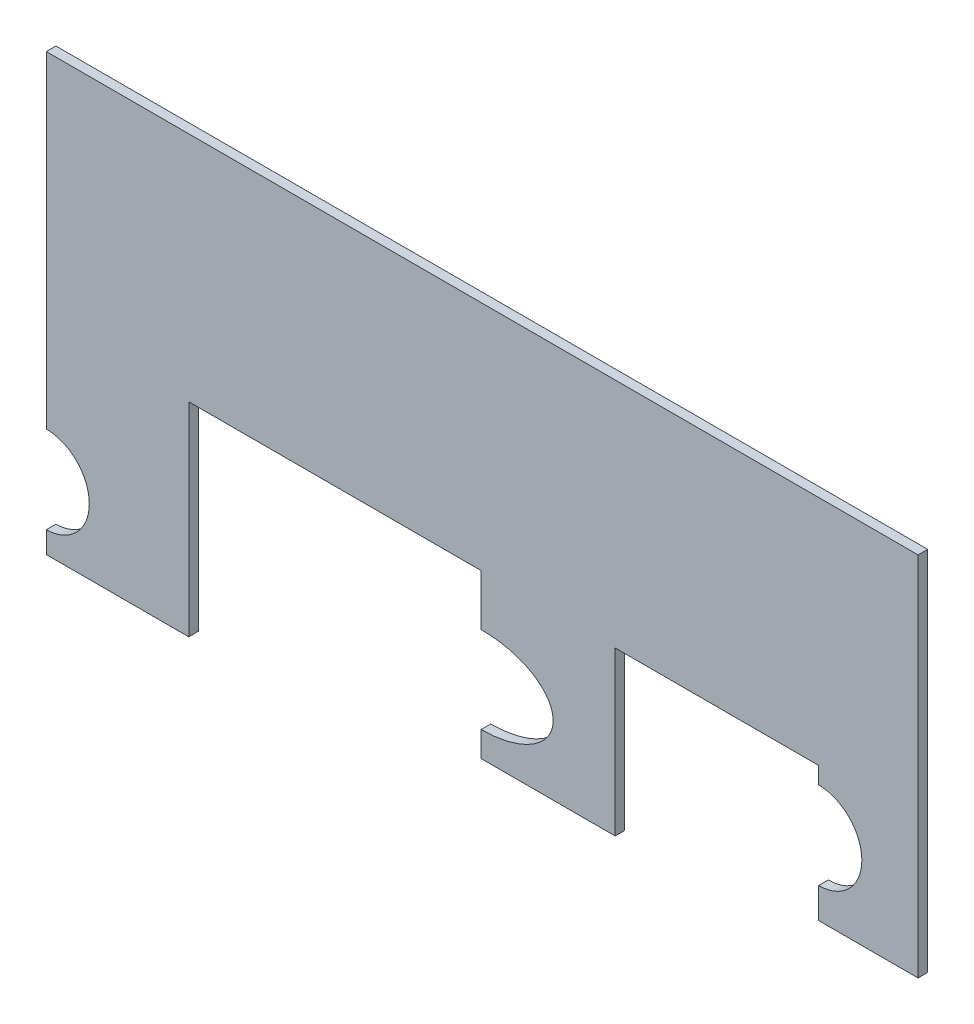
from build123d import *

# Parameters (mm, degrees)
BOSS_EXTRUDE3_OUTLINE_W = 330.2
BOSS_EXTRUDE3_OUTLINE_H = 190.5
BOSS_EXTRUDE3_DEPTH     = 3
CUT_EXTRUDE2_DEPTH      = 554.733952504


# Read off the part's stored shape, not the designer's step: Boss-Extrude3
with BuildPart() as part:
    # Boss-Extrude3 outline → Boss-Extrude3 (new body)
    with BuildSketch(Plane.XY):
        with Locations((-165.1, -349.25)):
            Rectangle(BOSS_EXTRUDE3_OUTLINE_W, BOSS_EXTRUDE3_OUTLINE_H)
        with BuildLine():
            add(Edge.make_bspline(
                [(-278.621518652, -381.53819229), (-278.370340025, -381.675788485), (-277.859461829, -381.935426093), (-276.719402462, -382.422402226), (-274.453837446, -383.121197535), (-270.353871795, -383.430649395), (-265.517981506, -381.766237097), (-262.122707267, -378.912933368), (-260.111865445, -376.132298445), (-258.851133292, -372.940751822), (-258.274482706, -368.543399957), (-259.475297643, -363.572067472), (-261.943328375, -360.2835567), (-263.751900196, -358.750531033), (-264.776043253, -358.051952395), (-265.516797717, -357.615831636), (-266.283115012, -357.226375224), (-267.423174378, -356.739399091), (-269.688739395, -356.040603782), (-273.788705045, -355.731151923), (-278.624595335, -357.395564221), (-282.019869573, -360.248867949), (-284.030711396, -363.029502872), (-285.291443548, -366.221049495), (-285.868094135, -370.61840136), (-284.667279197, -375.589733845), (-282.199248466, -378.878244617), (-280.390676644, -380.411270284), (-279.366533588, -381.109848922), (-278.872697278, -381.400596095), (-278.621518652, -381.53819229)],
                knots=[0, 0, 0, 0, 0.015625, 0.03125, 0.0625, 0.125, 0.1875, 0.21875, 0.25, 0.28125, 0.3125, 0.375, 0.4375, 0.46875, 0.484375, 0.5, 0.515625, 0.53125, 0.5625, 0.625, 0.6875, 0.71875, 0.75, 0.78125, 0.8125, 0.875, 0.9375, 0.96875, 0.984375, 1, 1, 1, 1], degree=3))
        make_face(mode=Mode.SUBTRACT)
        with BuildLine():
            add(Edge.make_bspline(
                [(-158.330065967, -356.075599307), (-158.327001416, -356.373395786), (-158.290080957, -356.968671877), (-158.067598918, -358.246608867), (-157.224453748, -360.63292192), (-154.882508758, -363.615638807), (-150.614101822, -366.327010398), (-146.438166973, -368.010630749), (-141.434805852, -369.121724295), (-135.953318408, -369.477027412), (-130.480303716, -369.0089942), (-125.500867751, -367.795170138), (-121.360465048, -366.025968397), (-117.148760273, -363.227330056), (-114.868693567, -360.19704918), (-114.074835681, -357.79389013), (-113.878699845, -356.511645246), (-113.84170646, -355.617780511), (-113.897087149, -354.724866375), (-114.119569188, -353.446929384), (-114.962714357, -351.060616332), (-117.304659348, -348.077899444), (-121.573066284, -345.366527853), (-125.749001132, -343.682907503), (-130.752362254, -342.571813956), (-136.233849698, -342.216510839), (-141.70686439, -342.684544051), (-146.686300354, -343.898368114), (-150.826703058, -345.667569854), (-155.038407833, -348.466208196), (-157.318474538, -351.496489072), (-158.112332425, -353.899648121), (-158.30846826, -355.181893006), (-158.333130517, -355.777802829), (-158.330065967, -356.075599307)],
                knots=[0, 0, 0, 0, 0.015625, 0.03125, 0.0625, 0.125, 0.15625, 0.1875, 0.21875, 0.25, 0.28125, 0.3125, 0.34375, 0.375, 0.4375, 0.46875, 0.484375, 0.5, 0.515625, 0.53125, 0.5625, 0.625, 0.65625, 0.6875, 0.71875, 0.75, 0.78125, 0.8125, 0.84375, 0.875, 0.9375, 0.96875, 0.984375, 1, 1, 1, 1], degree=3))
        make_face(mode=Mode.SUBTRACT)
        with BuildLine():
            add(Edge.make_bspline(
                [(-33.964165547, -331.962198832), (-34.243868077, -332.023492326), (-34.799490244, -332.1633419), (-35.978750805, -332.544818645), (-38.145753578, -333.504844289), (-41.440772349, -335.959441018), (-43.995962688, -340.379536121), (-44.684039348, -344.749082337), (-44.375298942, -348.156558861), (-43.230759499, -351.380879931), (-40.778421797, -355.062241557), (-36.608937685, -358.008703948), (-32.589384281, -358.86039887), (-30.219493581, -358.826218077), (-28.988771838, -358.679575761), (-28.143989915, -358.521589154), (-27.310556664, -358.311814794), (-26.131296103, -357.930338049), (-23.96429333, -356.970312405), (-20.669274558, -354.515715676), (-18.11408422, -350.095620573), (-17.42600756, -345.726074356), (-17.734747965, -342.318597833), (-18.879287408, -339.094276763), (-21.331625111, -335.412915137), (-25.501109223, -332.466452745), (-29.520662627, -331.614757823), (-31.890553327, -331.648938617), (-33.121275069, -331.795580933), (-33.684463018, -331.900905337), (-33.964165547, -331.962198832)],
                knots=[0, 0, 0, 0, 0.015625, 0.03125, 0.0625, 0.125, 0.1875, 0.21875, 0.25, 0.28125, 0.3125, 0.375, 0.4375, 0.46875, 0.484375, 0.5, 0.515625, 0.53125, 0.5625, 0.625, 0.6875, 0.71875, 0.75, 0.78125, 0.8125, 0.875, 0.9375, 0.96875, 0.984375, 1, 1, 1, 1], degree=3))
        make_face(mode=Mode.SUBTRACT)
    extrude(amount=BOSS_EXTRUDE3_DEPTH)

    # Sketch9 → Cut-Extrude2 (cut, through all)
    with BuildSketch(Plane(origin=(0, 0, 0), x_dir=(-1, 0, 0), z_dir=(0, 0, -1))):
        with BuildLine():
            Line((0, -444.5), (330.2, -444.5))
            Line((330.2, -444.5), (330.2, -254))
            Line((330.2, -254), (271.955362236, -254))
            Line((271.955362236, -254), (271.955362236, -355.976421692))
            add(Edge.make_bspline(
                [(271.955362236, -355.976421692), (272.59093246, -355.976421692), (274.983557944, -356.142395301), (278.624595335, -357.395564221), (282.019869573, -360.248867949), (284.030711396, -363.029502872), (285.291443548, -366.221049495), (285.868094135, -370.61840136), (284.667279197, -375.589733845), (282.199248466, -378.878244617), (280.390676644, -380.411270284), (279.366533588, -381.109848922), (278.872697278, -381.400596095), (278.621518652, -381.53819229)],
                knots=[0.601106286, 0.601106286, 0.601106286, 0.601106286, 0.625, 0.6875, 0.71875, 0.75, 0.78125, 0.8125, 0.875, 0.9375, 0.96875, 0.984375, 1, 1, 1, 1], degree=3))
            add(Edge.make_bspline(
                [(278.621518652, -381.53819229), (278.370340025, -381.675788485), (277.859461829, -381.935426093), (276.719402462, -382.422402226), (274.88887928, -382.98701238), (273.070063108, -383.202935147), (271.955362236, -383.183342538)],
                knots=[0, 0, 0, 0, 0.015625, 0.03125, 0.0625, 0.103997424, 0.103997424, 0.103997424, 0.103997424], degree=3))
            Line((271.955362236, -383.183342538), (271.955362236, -389.89))
            Line((271.955362236, -389.89), (227.505362236, -389.89))
            Line((227.505362236, -389.89), (227.505362236, -326.39))
            Line((227.505362236, -326.39), (136.330752091, -326.39))
            Line((136.330752091, -326.39), (136.330752091, -342.354877875))
            add(Edge.make_bspline(
                [(136.330752091, -342.354877875), (138.123654962, -342.378162739), (141.736657922, -342.691806742), (146.686300354, -343.898368114), (150.826703058, -345.667569854), (155.038407833, -348.466208196), (157.318474538, -351.496489072), (158.112332425, -353.899648121), (158.30846826, -355.181893006), (158.333130517, -355.777802829), (158.330065967, -356.075599307)],
                knots=[0.750560936, 0.750560936, 0.750560936, 0.750560936, 0.78125, 0.8125, 0.84375, 0.875, 0.9375, 0.96875, 0.984375, 1, 1, 1, 1], degree=3))
            add(Edge.make_bspline(
                [(158.330065967, -356.075599307), (158.327001416, -356.373395786), (158.290080957, -356.968671877), (158.067598918, -358.246608867), (157.224453748, -360.63292192), (154.882508758, -363.615638807), (150.614101822, -366.327010398), (146.438166973, -368.010630749), (141.549303862, -369.096297788), (138.03098442, -369.341737675), (136.330752091, -369.341737675)],
                knots=[0, 0, 0, 0, 0.015625, 0.03125, 0.0625, 0.125, 0.15625, 0.1875, 0.21875, 0.247854605, 0.247854605, 0.247854605, 0.247854605], degree=3))
            Line((136.330752091, -369.341737675), (136.330752091, -377.19))
            Line((136.330752091, -377.19), (94.512592051, -377.19))
            Line((94.512592051, -377.19), (94.512592051, -326.39))
            Line((94.512592051, -326.39), (31.012592051, -326.39))
            Line((31.012592051, -326.39), (31.012592051, -331.651825694))
            add(Edge.make_bspline(
                [(31.012592051, -331.651825694), (31.419012916, -331.649248653), (32.140901517, -331.678767974), (33.121275069, -331.795580933), (33.684463018, -331.900905337), (33.964165547, -331.962198832)],
                knots=[0.950213485, 0.950213485, 0.950213485, 0.950213485, 0.96875, 0.984375, 1, 1, 1, 1], degree=3))
            add(Edge.make_bspline(
                [(33.964165547, -331.962198832), (34.243868077, -332.023492326), (34.799490244, -332.1633419), (35.978750805, -332.544818645), (38.145753578, -333.504844289), (41.440772349, -335.959441018), (43.995962688, -340.379536121), (44.684039348, -344.749082337), (44.375298942, -348.156558861), (43.230759499, -351.380879931), (40.778421797, -355.062241557), (36.608937685, -358.008703948), (33.032964836, -358.766409497), (31.318148935, -358.823600105), (31.012592051, -358.823600105)],
                knots=[0, 0, 0, 0, 0.015625, 0.03125, 0.0625, 0.125, 0.1875, 0.21875, 0.25, 0.28125, 0.3125, 0.375, 0.4375, 0.451506925, 0.451506925, 0.451506925, 0.451506925], degree=3))
            Line((31.012592051, -358.823600105), (31.012592051, -368.3))
            Line((31.012592051, -368.3), (0, -368.3))
            Line((0, -368.3), (0, -444.5))
        make_face()
    extrude(amount=-CUT_EXTRUDE2_DEPTH, mode=Mode.SUBTRACT)


solid = part.part
